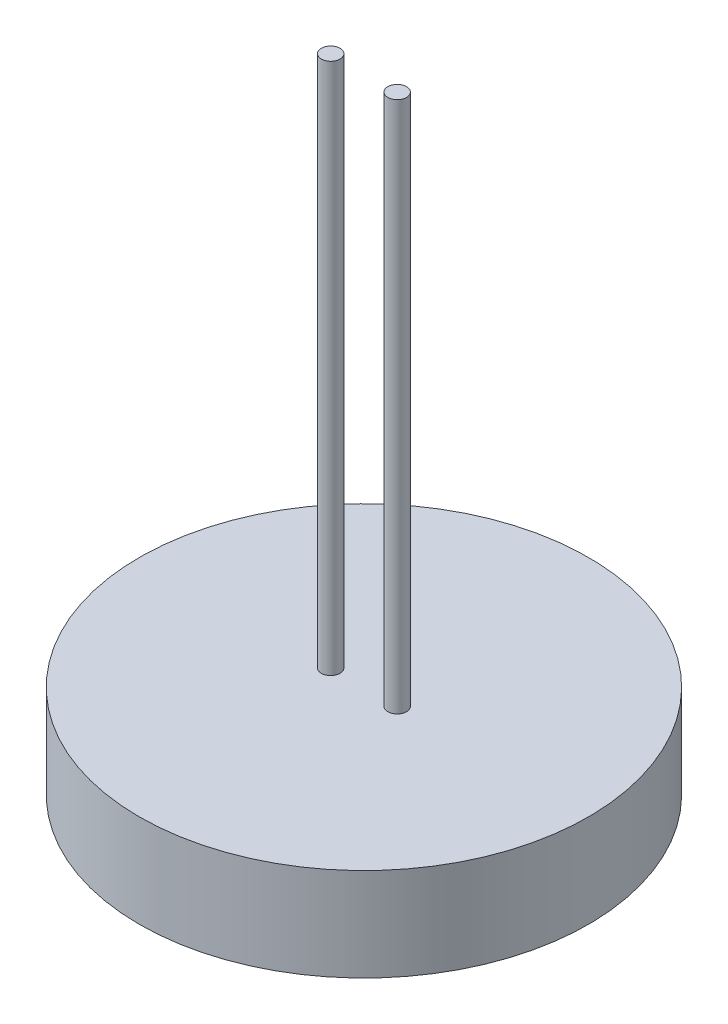
from build123d import *

# Parameters (mm, degrees)
SKETCH2_R                = 16.891
BOSS_EXTRUDE1_DEPTH      = 7
BOSS_EXTRUDE2_DEPTH      = 40
BOSS_EXTRUDE2_DEPTH_BACK = 17
SKETCH3_R                = 0.703637869


with BuildPart() as part:
    # Sketch2 → Boss-Extrude1 (new body)
    with BuildSketch(Plane(origin=(0, 0, 0), x_dir=(1, 0, 0), z_dir=(0, 1, 0))):
        Circle(SKETCH2_R)
    extrude(amount=BOSS_EXTRUDE1_DEPTH)

    # Sketch3 → Boss-Extrude2 (add, two sides: drawn at the far end of the back side and taken through both)
    with BuildSketch(Plane(origin=(0, 7, 0), x_dir=(1, 0, 0), z_dir=(0, 1, 0)).offset(-BOSS_EXTRUDE2_DEPTH_BACK)):
        with Locations((-2.5, 0)):
            Circle(SKETCH3_R)
        with Locations((2.5, 0)):
            Circle(SKETCH3_R)
    extrude(amount=BOSS_EXTRUDE2_DEPTH + BOSS_EXTRUDE2_DEPTH_BACK)


solid = part.part
